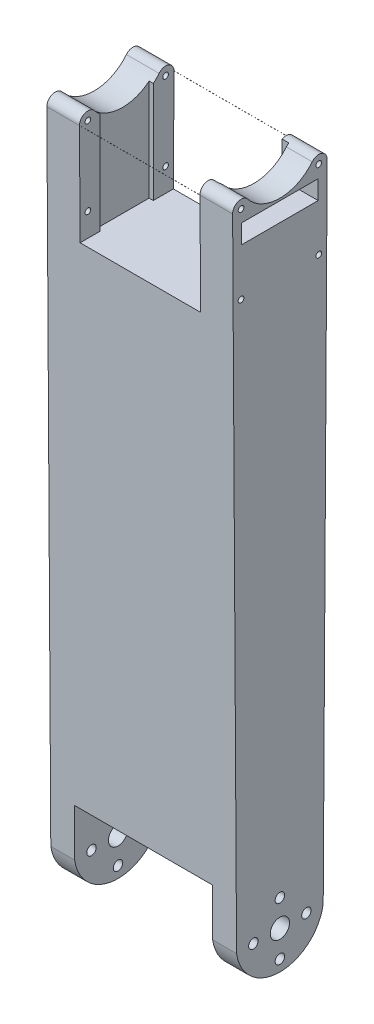
from build123d import *

# Parameters (mm, degrees)
BOSS_EXTRUDE1_DEPTH      = 24.511
BOSS_EXTRUDE1_DEPTH_BACK = 24.511
CUT_EXTRUDE3_DEPTH       = 212.61733137
CUT_EXTRUDE3_DEPTH_BACK  = 212.61733137
SKETCH3_4_R              = 1.250061
SKETCH3_4_R_2            = 0.750062
SKETCH3_4_R_3            = 2.54
CUT_EXTRUDE4_DEPTH       = 18.2000017
CUT_EXTRUDE4_DEPTH_BACK  = 18.2000017
SKETCH4_W                = 23.01416747
SKETCH4_H                = 23.93
CUT_EXTRUDE5_DEPTH       = 15.900019
CUT_EXTRUDE5_DEPTH_BACK  = 15.900019
SKETCH4_4_W              = 24.944915852
SKETCH4_4_H              = 29.1224716
SKETCH5_W                = 20.2
SKETCH5_H                = 5
CUT_EXTRUDE6_DEPTH       = 18.2000017
SKETCH5_3_W              = 18.4
SKETCH5_3_H              = 13.35
CUT_EXTRUDE7_DEPTH       = 1.7999964
SKETCH6_W                = 13.9999974
SKETCH6_H                = 29.1224716
CUT_EXTRUDE8_DEPTH       = 1.0999978
CUT_EXTRUDE10_DEPTH      = 212.61733137
CUT_EXTRUDE10_DEPTH_BACK = 212.61733137


with BuildPart() as part:
    # Sketch3 → Boss-Extrude1 (new, two sides: drawn at the far end of the back side and taken through both)
    with BuildSketch(Plane(origin=(0, 0, 0), x_dir=(0, 0, -1), z_dir=(1, 0, 0)).offset(-BOSS_EXTRUDE1_DEPTH_BACK)):
        with BuildLine():
            Line((-11.429783892, 38.029713575), (-12.472457926, 207.586478685))
            ThreePointArc((-12.472457926, 207.586478685), (-10.998297042, 209.692884773), (-8.522757463, 208.998766114))
            ThreePointArc((-8.522757463, 208.998766114), (0, 204.933486246), (8.522757463, 208.998766114))
            ThreePointArc((8.522757463, 208.998766114), (10.998297042, 209.692884773), (12.472457926, 207.586478685))
            Line((12.472457926, 207.586478685), (11.429783892, 38.029713575))
            ThreePointArc((11.429783892, 38.029713575), (0, 26.67), (-11.429783892, 38.029713575))
        make_face()
    extrude(amount=BOSS_EXTRUDE1_DEPTH + BOSS_EXTRUDE1_DEPTH_BACK)

    # Sketch3<4> → Cut-Extrude3 (cut, two sides: drawn at the far end of the back side and taken through both)
    with BuildSketch(Plane(origin=(0, 0, 0), x_dir=(0, 0, -1), z_dir=(1, 0, 0)).offset(-CUT_EXTRUDE3_DEPTH_BACK)):
        with Locations((0, 45.099986)):
            Circle(SKETCH3_4_R)
        with Locations((6.999986, 38.1)):
            Circle(SKETCH3_4_R)
        with Locations((0, 31.100014)):
            Circle(SKETCH3_4_R)
        with Locations((-6.999986, 38.1)):
            Circle(SKETCH3_4_R)
        with Locations((-10.249999947, 186.90016149)):
            Circle(SKETCH3_4_R_2)
        with Locations((10.249999947, 186.90016149)):
            Circle(SKETCH3_4_R_2)
        with Locations((10.249999947, 207.60014549)):
            Circle(SKETCH3_4_R_2)
        with Locations((-10.249999947, 207.60014549)):
            Circle(SKETCH3_4_R_2)
        with Locations((0, 38.1)):
            Circle(SKETCH3_4_R_3)
    extrude(amount=CUT_EXTRUDE3_DEPTH + CUT_EXTRUDE3_DEPTH_BACK, mode=Mode.SUBTRACT)

    # Sketch4 → Cut-Extrude4 (cut, two sides: drawn at the far end of the back side and taken through both)
    with BuildSketch(Plane(origin=(0, 0, 0), x_dir=(0, 0, -1), z_dir=(1, 0, 0)).offset(-CUT_EXTRUDE4_DEPTH_BACK)):
        with Locations((0, 38.635)):
            Rectangle(SKETCH4_W, SKETCH4_H)
    extrude(amount=CUT_EXTRUDE4_DEPTH + CUT_EXTRUDE4_DEPTH_BACK, mode=Mode.SUBTRACT)

    # Sketch4<4> → Cut-Extrude5 (cut, two sides: drawn at the far end of the back side and taken through both)
    with BuildSketch(Plane(origin=(0, 0, 0), x_dir=(0, 0, -1), z_dir=(1, 0, 0)).offset(-CUT_EXTRUDE5_DEPTH_BACK)):
        with Locations((0, 195.26140969)):
            Rectangle(SKETCH4_4_W, SKETCH4_4_H)
    extrude(amount=CUT_EXTRUDE5_DEPTH + CUT_EXTRUDE5_DEPTH_BACK, mode=Mode.SUBTRACT)

    # Sketch5 → Cut-Extrude6 (cut)
    with BuildSketch(Plane.ZY.offset(-15.900019)):
        with Locations((5.3e-08, 201.85014549)):
            Rectangle(SKETCH5_W, SKETCH5_H)
    extrude(amount=-CUT_EXTRUDE6_DEPTH, mode=Mode.SUBTRACT)

    # Sketch5<3> → Cut-Extrude7 (cut)
    with BuildSketch(Plane.ZY.offset(-15.900019)):
        with BuildLine():
            Line((-9.199999947, 209.558973264), (-9.199999947, 204.35014549))
            Line((-9.199999947, 204.35014549), (9.200000053, 204.35014549))
            Line((9.200000053, 204.35014549), (9.200000053, 209.558973321))
            ThreePointArc((9.200000053, 209.558973321), (8.833410085, 209.31268145), (8.522757463, 208.998766114))
            ThreePointArc((8.522757463, 208.998766114), (0, 204.933486246), (-8.522757463, 208.998766114))
            ThreePointArc((-8.522757463, 208.998766114), (-8.833410039, 209.312681412), (-9.199999947, 209.558973264))
        make_face()
        with Locations((5.3e-08, 192.67514549)):
            Rectangle(SKETCH5_3_W, SKETCH5_3_H)
    extrude(amount=-CUT_EXTRUDE7_DEPTH, mode=Mode.SUBTRACT)

    # Sketch6 → Cut-Extrude8 (cut)
    with BuildSketch(Plane(origin=(-15.900019, 0, 0), x_dir=(0, 0, -1), z_dir=(1, 0, 0))):
        with Locations((0, 195.26140969)):
            Rectangle(SKETCH6_W, SKETCH6_H)
    extrude(amount=-CUT_EXTRUDE8_DEPTH, mode=Mode.SUBTRACT)

    # Sketch3<5> → Cut-Extrude10 (cut, two sides: drawn at the far end of the back side and taken through both)
    with BuildSketch(Plane(origin=(0, 0, 0), x_dir=(0, 0, -1), z_dir=(1, 0, 0)).offset(-CUT_EXTRUDE10_DEPTH_BACK)):
        with BuildLine():
            ThreePointArc((0, 28.10002), (-7.57031661, 30.929140969), (-11.429783892, 38.029713575))
            ThreePointArc((-11.429783892, 38.029713575), (0, 26.67), (11.429783892, 38.029713575))
            ThreePointArc((11.429783892, 38.029713575), (7.57031661, 30.929140969), (0, 28.10002))
        make_face()
    extrude(amount=CUT_EXTRUDE10_DEPTH + CUT_EXTRUDE10_DEPTH_BACK, mode=Mode.SUBTRACT)


solid = part.part
